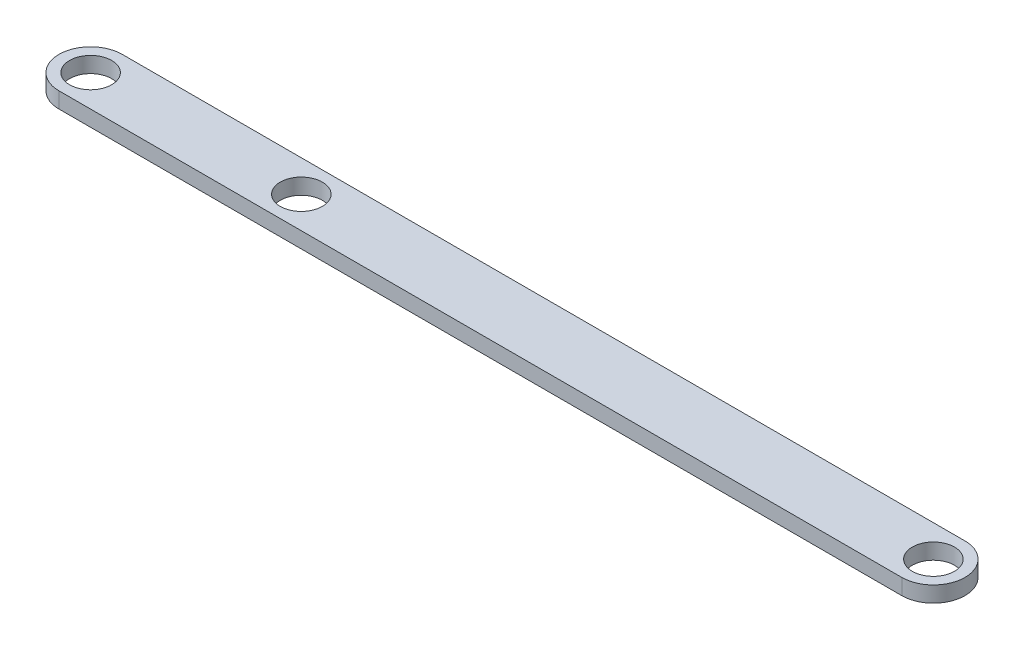
from build123d import *

# Parameters (mm, degrees)
SKETCH1_R           = 4
BOSS_EXTRUDE1_DEPTH = 3
SKETCH2_R           = 4
CUT_EXTRUDE1_DEPTH  = 167.135486877


with BuildPart() as part:
    # Sketch1 → Boss-Extrude1 (new body)
    with BuildSketch(Plane(origin=(0, 0, 0), x_dir=(1, 0, 0), z_dir=(0, 1, 0))):
        with BuildLine():
            Line((0, 6), (160, 6))
            ThreePointArc((160, 6), (166, 0), (160, -6))
            Line((160, -6), (0, -6))
            ThreePointArc((0, -6), (-6, 0), (0, 6))
        make_face()
        Circle(SKETCH1_R, mode=Mode.SUBTRACT)
        with Locations((160, 0)):
            Circle(SKETCH1_R, mode=Mode.SUBTRACT)
    extrude(amount=BOSS_EXTRUDE1_DEPTH)

    # Sketch2 → Cut-Extrude1 (cut, through all)
    with BuildSketch(Plane(origin=(0, 3, 0), x_dir=(1, 0, 0), z_dir=(0, 1, 0))):
        with Locations((40, 0)):
            Circle(SKETCH2_R)
    extrude(amount=-CUT_EXTRUDE1_DEPTH, mode=Mode.SUBTRACT)


solid = part.part
